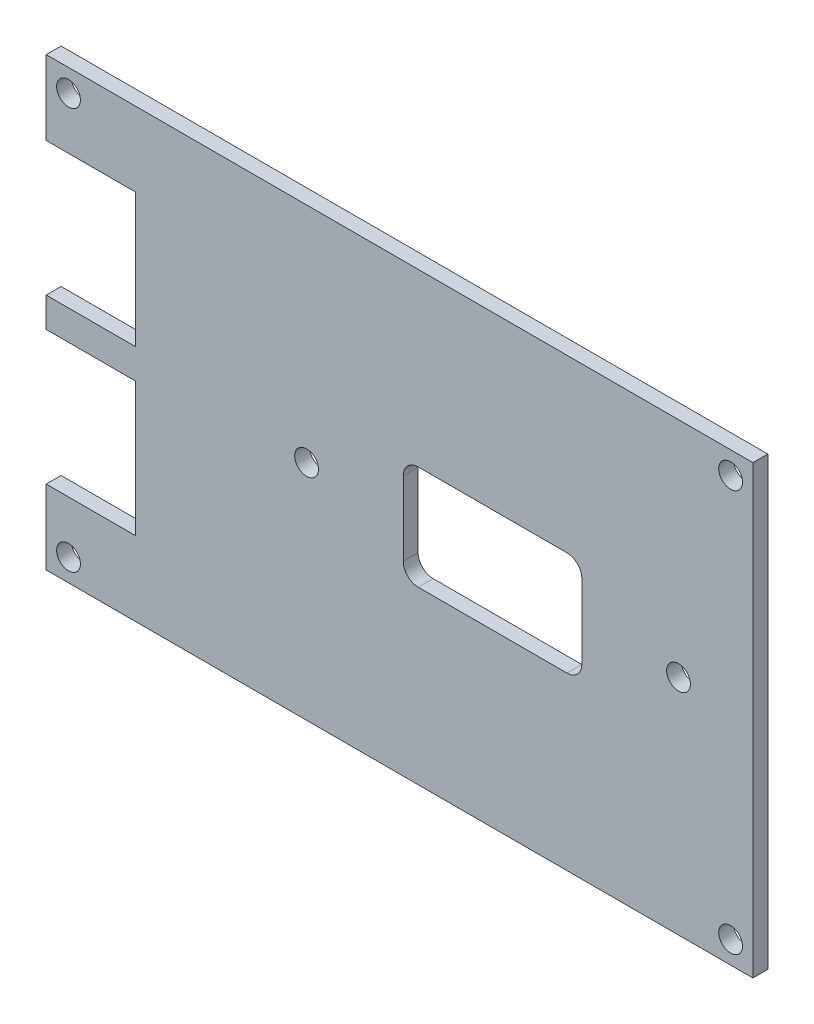
from build123d import *

# Parameters (mm, degrees)
SKETCH1_R           = 1.6
BOSS_EXTRUDE1_DEPTH = 2


with BuildPart() as part:
    # Sketch1 → Boss-Extrude1 (new body)
    with BuildSketch(Plane.XY):
        Polygon((-39.5636369, 18.881491211), (55.4363631, 18.881491211), (55.4363631, -41.118508789), (-39.5636369, -41.118508789), (-39.5636369, -31.118508789), (-27.5636369, -31.118508789), (-27.5636369, -13.118508789), (-39.5636369, -13.118508789), (-39.5636369, -9.118508789), (-27.5636369, -9.118508789), (-27.5636369, 8.881491211), (-39.5636369, 8.881491211), align=None)
        with Locations((45.4363631, -11.118508789)):
            Circle(SKETCH1_R, mode=Mode.SUBTRACT)
        with Locations((-4.5636369, -11.118508789)):
            Circle(SKETCH1_R, mode=Mode.SUBTRACT)
        with Locations((-36.5636369, 15.881491211)):
            Circle(SKETCH1_R, mode=Mode.SUBTRACT)
        with Locations((52.4363631, 15.881491211)):
            Circle(SKETCH1_R, mode=Mode.SUBTRACT)
        with Locations((-36.5636369, -38.118508789)):
            Circle(SKETCH1_R, mode=Mode.SUBTRACT)
        with Locations((52.4363631, -38.118508789)):
            Circle(SKETCH1_R, mode=Mode.SUBTRACT)
        with BuildLine():
            Line((10.4363631, -4.118508789), (30.4363631, -4.118508789))
            ThreePointArc((30.4363631, -4.118508789), (31.850576663, -4.704295227), (32.4363631, -6.118508789))
            Line((32.4363631, -6.118508789), (32.4363631, -16.118508789))
            ThreePointArc((32.4363631, -16.118508789), (31.850576663, -17.532722351), (30.4363631, -18.118508789))
            Line((30.4363631, -18.118508789), (10.4363631, -18.118508789))
            ThreePointArc((10.4363631, -18.118508789), (9.022149538, -17.532722351), (8.4363631, -16.118508789))
            Line((8.4363631, -16.118508789), (8.4363631, -6.118508789))
            ThreePointArc((8.4363631, -6.118508789), (9.022149538, -4.704295227), (10.4363631, -4.118508789))
        make_face(mode=Mode.SUBTRACT)
    extrude(amount=BOSS_EXTRUDE1_DEPTH)


solid = part.part
